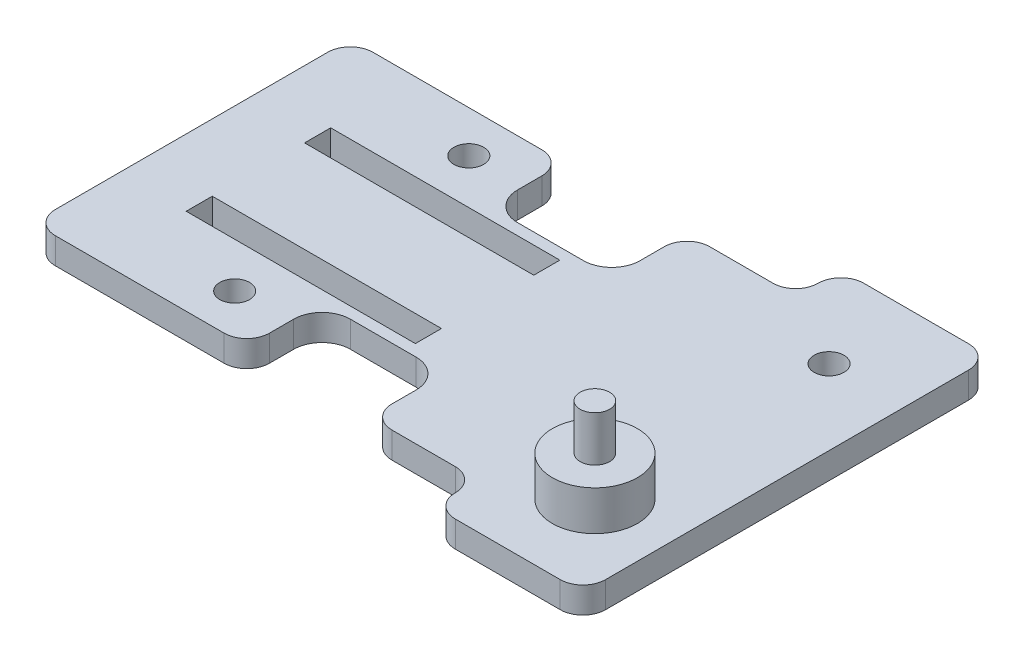
from build123d import *

# Parameters (mm, degrees)
EXTRUDE_1_DEPTH     = 4.6
SKETCH_1_R          = 2.625
SKETCH_1_W          = 40.4
SKETCH_1_H          = 4.6
CUT_EXTRUDE_1_DEPTH = 4.6
SKETCH_5_R          = 7.5
EXTRUDE_2_DEPTH     = 7
SKETCH_6_R          = 2.6
EXTRUDE_3_DEPTH     = 8
FILLET_1_R          = 5
FILLET_2_R          = 4


with BuildPart() as part:
    # 草图3 → 凸台-拉伸1 (new body)
    with BuildSketch(Plane(origin=(0, 0, 0), x_dir=(1, 0, 0), z_dir=(0, 1, 0))):
        Polygon((-40, 28), (-60, 28), (-60, -28), (-40, -28), (18.5, -28), (18.5, -36), (45, -36), (45, -28), (45, 28), (45, 36), (18.5, 36), (18.5, 28), align=None)
    extrude(amount=EXTRUDE_1_DEPTH)

    # 草图1 → 切除-拉伸1 (cut)
    with BuildSketch(Plane(origin=(0, 0, 0), x_dir=(1, 0, 0), z_dir=(0, 1, 0))):
        with Locations(Location((-31.75, 20.6375, 0), (0, 0, 270))):
            Circle(SKETCH_1_R)
        with Locations(Location((31.75, 20.6375, 0), (0, 0, 90))):
            Circle(SKETCH_1_R)
        with Locations(Location((31.75, -20.6375, 0), (0, 0, 270))):
            Circle(SKETCH_1_R)
        with Locations(Location((-31.75, -20.6375, 0), (0, 0, 90))):
            Circle(SKETCH_1_R)
        with Locations((-28, -10.4375)):
            Rectangle(SKETCH_1_W, SKETCH_1_H)
        with Locations((-28, 10.4375)):
            Rectangle(SKETCH_1_W, SKETCH_1_H)
        Polygon((-22.25, -26.5375), (-22.25, -14.7375), (-0.65, -14.7375), (-0.65, -26.5375), (-0.65, -30.009482824), (-22.25, -30.009482824), align=None)
        Polygon((-22.25, 14.7375), (-0.65, 14.7375), (-0.65, 26.5375), (-0.65, 30.009482824), (-22.25, 30.009482824), (-22.25, 26.5375), align=None)
    extrude(amount=CUT_EXTRUDE_1_DEPTH, mode=Mode.SUBTRACT)

    # 草图5 → 凸台-拉伸2 (add)
    with BuildSketch(Plane(origin=(0, 4.6, 0), x_dir=(1, 0, 0), z_dir=(0, 1, 0))):
        with Locations(Location((31.75, -20.6375, 0), (0, 0, 270))):
            Circle(SKETCH_5_R)
    extrude(amount=EXTRUDE_2_DEPTH)

    # 草图6 → 凸台-拉伸3 (add)
    with BuildSketch(Plane(origin=(0, 11.6, 0), x_dir=(1, 0, 0), z_dir=(0, 1, 0))):
        with Locations(Location((31.75, -20.6375, 0), (0, 0, 270))):
            Circle(SKETCH_6_R)
    extrude(amount=EXTRUDE_3_DEPTH)

    # 圆角1
    fillet_1_edges = [part.edges().sort_by_distance(p)[0] for p in [
        (-22.25, 2.3, 14.7375),
        (-0.65, 2.3, 14.7375),
        (-0.65, 2.3, -14.7375),
        (-22.25, 2.3, -14.7375),
    ]]
    fillet(fillet_1_edges, radius=FILLET_1_R)

    # 圆角2
    fillet_2_edges = [part.edges().sort_by_distance(p)[0] for p in [
        (-0.65, 2.3, 28),
        (-22.25, 2.3, 28),
        (-0.65, 2.3, -28),
        (-22.25, 2.3, -28),
        (-60, 2.3, 28),
        (-60, 2.3, -28),
        (18.5, 2.3, -28),
        (18.5, 2.3, -36),
        (45, 2.3, -36),
        (45, 2.3, 36),
        (18.5, 2.3, 36),
        (18.5, 2.3, 28),
    ]]
    fillet(fillet_2_edges, radius=FILLET_2_R - 0.0001)  # a hair under: the kernel refuses the full size


solid = part.part
